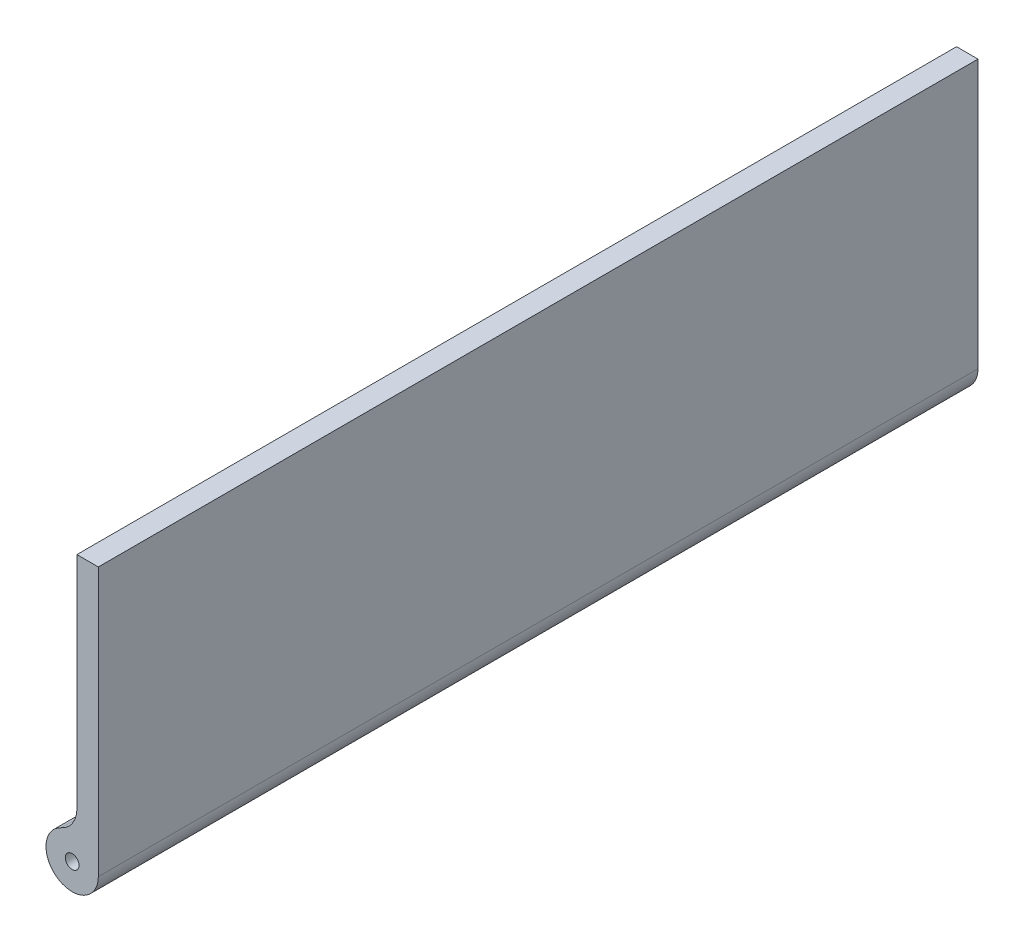
from build123d import *

# Parameters (mm, degrees)
SKETCH1_R           = 0.64
BOSS_EXTRUDE1_DEPTH = 82


with BuildPart() as part:
    # Sketch1 → Boss-Extrude1 (new body)
    with BuildSketch(Plane.XY):
        with BuildLine():
            Line((2.44, 0), (2.44, 25))
            Line((2.44, 25), (0.44, 25))
            Line((0.44, 25), (0.44, 4.489988864))
            ThreePointArc((0.44, 4.489988864), (0.044314057, 3.140225052), (-1.017489879, 2.217727293))
            ThreePointArc((-1.017489879, 2.217727293), (-1.317369481, -2.05381052), (2.44, 0))
        make_face()
        Circle(SKETCH1_R, mode=Mode.SUBTRACT)
    extrude(amount=BOSS_EXTRUDE1_DEPTH)


solid = part.part
